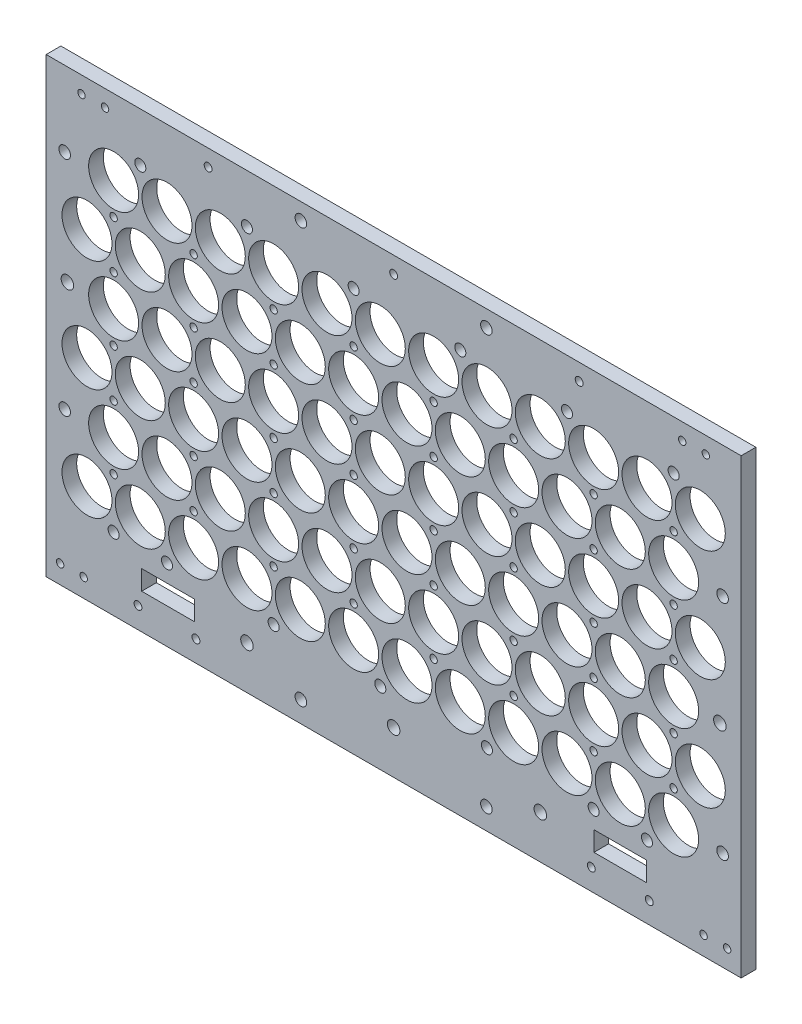
from build123d import *

# Parameters (mm, degrees)
SKETCH1_W                  = 299.700000132
SKETCH1_H                  = 194.250000104
BOSS_EXTRUDE1_DEPTH        = 6.35
CUT_EXTRUDE1_DEPTH         = 182.719853184
SKETCH4_R                  = 10.775
CUT_EXTRUDE2_DEPTH         = 182.719853184
LPATTERN1_COUNT            = 12
LPATTERN1_PITCH            = 23
LPATTERN2_COPY_1_DEPTH     = 182.719853184
LPATTERN2_COPY_2_DEPTH     = 182.719853184
LPATTERN2_COPY_3_DEPTH     = 182.719853184
LPATTERN2_COPY_4_DEPTH     = 182.719853184
LPATTERN2_COPY_5_DEPTH     = 182.719853184
LPATTERN2_COPY_6_DEPTH     = 182.719853184
LPATTERN2_COPY_7_DEPTH     = 182.719853184
LPATTERN2_COPY_8_DEPTH     = 182.719853184
LPATTERN2_COPY_9_DEPTH     = 182.719853184
LPATTERN2_COPY_10_DEPTH    = 182.719853184
LPATTERN2_COPY_11_DEPTH    = 182.719853184
LPATTERN2_COPY_12_DEPTH    = 182.719853184
LPATTERN2_COPY_13_DEPTH    = 182.719853184
LPATTERN2_COPY_14_DEPTH    = 182.719853184
LPATTERN2_COPY_15_DEPTH    = 182.719853184
LPATTERN2_COPY_16_DEPTH    = 182.719853184
LPATTERN2_COPY_17_DEPTH    = 182.719853184
LPATTERN2_COPY_18_DEPTH    = 182.719853184
LPATTERN2_COPY_19_DEPTH    = 182.719853184
LPATTERN2_COPY_20_DEPTH    = 182.719853184
LPATTERN2_COPY_21_DEPTH    = 182.719853184
LPATTERN2_COPY_22_DEPTH    = 182.719853184
LPATTERN2_COPY_23_SKETCH_R = 10.775
LPATTERN2_COPY_23_DEPTH    = 182.719853184
LPATTERN2_COPY_24_SKETCH_R = 10.775
LPATTERN2_COPY_24_DEPTH    = 182.719853184
LPATTERN2_COPY_25_SKETCH_R = 10.775
LPATTERN2_COPY_25_DEPTH    = 182.719853184
LPATTERN2_COPY_26_SKETCH_R = 10.775
LPATTERN2_COPY_26_DEPTH    = 182.719853184
LPATTERN2_COPY_27_SKETCH_R = 10.775
LPATTERN2_COPY_27_DEPTH    = 182.719853184
LPATTERN2_COPY_28_SKETCH_R = 10.775
LPATTERN2_COPY_28_DEPTH    = 182.719853184
LPATTERN2_COPY_29_SKETCH_R = 10.775
LPATTERN2_COPY_29_DEPTH    = 182.719853184
LPATTERN2_COPY_30_SKETCH_R = 10.775
LPATTERN2_COPY_30_DEPTH    = 182.719853184
LPATTERN2_COPY_31_SKETCH_R = 10.775
LPATTERN2_COPY_31_DEPTH    = 182.719853184
LPATTERN2_COPY_32_SKETCH_R = 10.775
LPATTERN2_COPY_32_DEPTH    = 182.719853184
LPATTERN2_COPY_33_SKETCH_R = 10.775
LPATTERN2_COPY_33_DEPTH    = 182.719853184
LPATTERN2_COPY_34_SKETCH_R = 10.775
LPATTERN2_COPY_34_DEPTH    = 182.719853184
LPATTERN2_COPY_35_SKETCH_R = 10.775
LPATTERN2_COPY_35_DEPTH    = 182.719853184
LPATTERN2_COPY_36_SKETCH_R = 10.775
LPATTERN2_COPY_36_DEPTH    = 182.719853184
LPATTERN2_COPY_37_SKETCH_R = 10.775
LPATTERN2_COPY_37_DEPTH    = 182.719853184
LPATTERN2_COPY_38_SKETCH_R = 10.775
LPATTERN2_COPY_38_DEPTH    = 182.719853184
LPATTERN2_COPY_39_SKETCH_R = 10.775
LPATTERN2_COPY_39_DEPTH    = 182.719853184
LPATTERN2_COPY_40_SKETCH_R = 10.775
LPATTERN2_COPY_40_DEPTH    = 182.719853184
LPATTERN2_COPY_41_SKETCH_R = 10.775
LPATTERN2_COPY_41_DEPTH    = 182.719853184
LPATTERN2_COPY_42_SKETCH_R = 10.775
LPATTERN2_COPY_42_DEPTH    = 182.719853184
LPATTERN2_COPY_43_SKETCH_R = 10.775
LPATTERN2_COPY_43_DEPTH    = 182.719853184
LPATTERN2_COPY_44_SKETCH_R = 10.775
LPATTERN2_COPY_44_DEPTH    = 182.719853184
LPATTERN2_COPY_45_DEPTH    = 182.719853184
LPATTERN2_COPY_46_DEPTH    = 182.719853184
LPATTERN2_COPY_47_SKETCH_R = 10.775
LPATTERN2_COPY_47_DEPTH    = 182.719853184
LPATTERN2_COPY_48_SKETCH_R = 10.775
LPATTERN2_COPY_48_DEPTH    = 182.719853184
SKETCH5_W                  = 22.76
SKETCH5_H                  = 8.4615
CUT_EXTRUDE3_DEPTH         = 182.719853184
M3_CLEARANCE_HOLE1_D       = 3.2
M3_CLEARANCE_HOLE2_D       = 3.4
SKETCH14_R                 = 2.7
CUT_EXTRUDE4_DEPTH         = 182.719853184
SKETCH15_R                 = 2.5
CUT_EXTRUDE5_DEPTH         = 182.719853184
SKETCH16_R                 = 1.5875
CUT_EXTRUDE6_DEPTH         = 182.719853184
LPATTERN3_COUNT            = 4
LPATTERN3_PITCH            = 69
SKETCH18_R                 = 2.38125
CUT_EXTRUDE7_DEPTH         = 182.719853184
SKETCH19_W                 = 299.700000132
SKETCH19_H                 = 6.35
BOSS_EXTRUDE2_DEPTH        = 0.79375


with BuildPart() as part:
    # Sketch1 → Boss-Extrude1 (new body)
    with BuildSketch(Plane.XY):
        with Locations((0, -5.475000052)):
            Rectangle(SKETCH1_W, SKETCH1_H)
    extrude(amount=BOSS_EXTRUDE1_DEPTH)

    # Sketch3 → Cut-Extrude1 (cut, through all)
    with BuildSketch(Plane.XY.offset(6.35)):
        with BuildLine():
            ThreePointArc((-121.475, -60), (-132.24999993, -49.225), (-143.025, -59.999999859))
            ThreePointArc((-143.025, -59.999999859), (-139.869075617, -67.619075517), (-132.25, -70.775))
            ThreePointArc((-132.25, -70.775), (-124.630924433, -67.619075567), (-121.475, -60))
        make_face()
    cut_extrude1 = extrude(amount=-CUT_EXTRUDE1_DEPTH, mode=Mode.SUBTRACT)

    # Sketch4 → Cut-Extrude2 (cut, through all)
    with BuildSketch(Plane.XY.offset(6.35)):
        with Locations((-120.75, -36)):
            Circle(SKETCH4_R)
    cut_extrude2 = extrude(amount=-CUT_EXTRUDE2_DEPTH, mode=Mode.SUBTRACT)

    # LPattern1: Cut-Extrude1, Cut-Extrude2 ×12
    with Locations(*[(i * LPATTERN1_PITCH, 0, 0) for i in range(1, LPATTERN1_COUNT)]):
        add(cut_extrude1, mode=Mode.SUBTRACT)
        add(cut_extrude2, mode=Mode.SUBTRACT)

    # LPattern2 copy 1 sketch → LPattern2 copy 1 (cut, through all)
    with BuildSketch(Plane(origin=(23, 48, 6.35), x_dir=(1, 0, 0), z_dir=(0, 0, 1))):
        with BuildLine():
            ThreePointArc((-121.475, -60), (-132.24999993, -49.225), (-143.025, -59.999999859))
            ThreePointArc((-143.025, -59.999999859), (-139.869075617, -67.619075517), (-132.25, -70.775))
            ThreePointArc((-132.25, -70.775), (-124.630924433, -67.619075567), (-121.475, -60))
        make_face()
    extrude(amount=-LPATTERN2_COPY_1_DEPTH, mode=Mode.SUBTRACT)

    # LPattern2 copy 2 sketch → LPattern2 copy 2 (cut, through all)
    with BuildSketch(Plane(origin=(23, 96, 6.35), x_dir=(1, 0, 0), z_dir=(0, 0, 1))):
        with BuildLine():
            ThreePointArc((-121.475, -60), (-132.24999993, -49.225), (-143.025, -59.999999859))
            ThreePointArc((-143.025, -59.999999859), (-139.869075617, -67.619075517), (-132.25, -70.775))
            ThreePointArc((-132.25, -70.775), (-124.630924433, -67.619075567), (-121.475, -60))
        make_face()
    extrude(amount=-LPATTERN2_COPY_2_DEPTH, mode=Mode.SUBTRACT)

    # LPattern2 copy 3 sketch → LPattern2 copy 3 (cut, through all)
    with BuildSketch(Plane(origin=(46, 48, 6.35), x_dir=(1, 0, 0), z_dir=(0, 0, 1))):
        with BuildLine():
            ThreePointArc((-121.475, -60), (-132.24999993, -49.225), (-143.025, -59.999999859))
            ThreePointArc((-143.025, -59.999999859), (-139.869075617, -67.619075517), (-132.25, -70.775))
            ThreePointArc((-132.25, -70.775), (-124.630924433, -67.619075567), (-121.475, -60))
        make_face()
    extrude(amount=-LPATTERN2_COPY_3_DEPTH, mode=Mode.SUBTRACT)

    # LPattern2 copy 4 sketch → LPattern2 copy 4 (cut, through all)
    with BuildSketch(Plane(origin=(46, 96, 6.35), x_dir=(1, 0, 0), z_dir=(0, 0, 1))):
        with BuildLine():
            ThreePointArc((-121.475, -60), (-132.24999993, -49.225), (-143.025, -59.999999859))
            ThreePointArc((-143.025, -59.999999859), (-139.869075617, -67.619075517), (-132.25, -70.775))
            ThreePointArc((-132.25, -70.775), (-124.630924433, -67.619075567), (-121.475, -60))
        make_face()
    extrude(amount=-LPATTERN2_COPY_4_DEPTH, mode=Mode.SUBTRACT)

    # LPattern2 copy 5 sketch → LPattern2 copy 5 (cut, through all)
    with BuildSketch(Plane(origin=(69, 48, 6.35), x_dir=(1, 0, 0), z_dir=(0, 0, 1))):
        with BuildLine():
            ThreePointArc((-121.475, -60), (-132.24999993, -49.225), (-143.025, -59.999999859))
            ThreePointArc((-143.025, -59.999999859), (-139.869075617, -67.619075517), (-132.25, -70.775))
            ThreePointArc((-132.25, -70.775), (-124.630924433, -67.619075567), (-121.475, -60))
        make_face()
    extrude(amount=-LPATTERN2_COPY_5_DEPTH, mode=Mode.SUBTRACT)

    # LPattern2 copy 6 sketch → LPattern2 copy 6 (cut, through all)
    with BuildSketch(Plane(origin=(69, 96, 6.35), x_dir=(1, 0, 0), z_dir=(0, 0, 1))):
        with BuildLine():
            ThreePointArc((-121.475, -60), (-132.24999993, -49.225), (-143.025, -59.999999859))
            ThreePointArc((-143.025, -59.999999859), (-139.869075617, -67.619075517), (-132.25, -70.775))
            ThreePointArc((-132.25, -70.775), (-124.630924433, -67.619075567), (-121.475, -60))
        make_face()
    extrude(amount=-LPATTERN2_COPY_6_DEPTH, mode=Mode.SUBTRACT)

    # LPattern2 copy 7 sketch → LPattern2 copy 7 (cut, through all)
    with BuildSketch(Plane(origin=(92, 48, 6.35), x_dir=(1, 0, 0), z_dir=(0, 0, 1))):
        with BuildLine():
            ThreePointArc((-121.475, -60), (-132.24999993, -49.225), (-143.025, -59.999999859))
            ThreePointArc((-143.025, -59.999999859), (-139.869075617, -67.619075517), (-132.25, -70.775))
            ThreePointArc((-132.25, -70.775), (-124.630924433, -67.619075567), (-121.475, -60))
        make_face()
    extrude(amount=-LPATTERN2_COPY_7_DEPTH, mode=Mode.SUBTRACT)

    # LPattern2 copy 8 sketch → LPattern2 copy 8 (cut, through all)
    with BuildSketch(Plane(origin=(92, 96, 6.35), x_dir=(1, 0, 0), z_dir=(0, 0, 1))):
        with BuildLine():
            ThreePointArc((-121.475, -60), (-132.24999993, -49.225), (-143.025, -59.999999859))
            ThreePointArc((-143.025, -59.999999859), (-139.869075617, -67.619075517), (-132.25, -70.775))
            ThreePointArc((-132.25, -70.775), (-124.630924433, -67.619075567), (-121.475, -60))
        make_face()
    extrude(amount=-LPATTERN2_COPY_8_DEPTH, mode=Mode.SUBTRACT)

    # LPattern2 copy 9 sketch → LPattern2 copy 9 (cut, through all)
    with BuildSketch(Plane(origin=(115, 48, 6.35), x_dir=(1, 0, 0), z_dir=(0, 0, 1))):
        with BuildLine():
            ThreePointArc((-121.475, -60), (-132.24999993, -49.225), (-143.025, -59.999999859))
            ThreePointArc((-143.025, -59.999999859), (-139.869075617, -67.619075517), (-132.25, -70.775))
            ThreePointArc((-132.25, -70.775), (-124.630924433, -67.619075567), (-121.475, -60))
        make_face()
    extrude(amount=-LPATTERN2_COPY_9_DEPTH, mode=Mode.SUBTRACT)

    # LPattern2 copy 10 sketch → LPattern2 copy 10 (cut, through all)
    with BuildSketch(Plane(origin=(115, 96, 6.35), x_dir=(1, 0, 0), z_dir=(0, 0, 1))):
        with BuildLine():
            ThreePointArc((-121.475, -60), (-132.24999993, -49.225), (-143.025, -59.999999859))
            ThreePointArc((-143.025, -59.999999859), (-139.869075617, -67.619075517), (-132.25, -70.775))
            ThreePointArc((-132.25, -70.775), (-124.630924433, -67.619075567), (-121.475, -60))
        make_face()
    extrude(amount=-LPATTERN2_COPY_10_DEPTH, mode=Mode.SUBTRACT)

    # LPattern2 copy 11 sketch → LPattern2 copy 11 (cut, through all)
    with BuildSketch(Plane(origin=(138, 48, 6.35), x_dir=(1, 0, 0), z_dir=(0, 0, 1))):
        with BuildLine():
            ThreePointArc((-121.475, -60), (-132.24999993, -49.225), (-143.025, -59.999999859))
            ThreePointArc((-143.025, -59.999999859), (-139.869075617, -67.619075517), (-132.25, -70.775))
            ThreePointArc((-132.25, -70.775), (-124.630924433, -67.619075567), (-121.475, -60))
        make_face()
    extrude(amount=-LPATTERN2_COPY_11_DEPTH, mode=Mode.SUBTRACT)

    # LPattern2 copy 12 sketch → LPattern2 copy 12 (cut, through all)
    with BuildSketch(Plane(origin=(138, 96, 6.35), x_dir=(1, 0, 0), z_dir=(0, 0, 1))):
        with BuildLine():
            ThreePointArc((-121.475, -60), (-132.24999993, -49.225), (-143.025, -59.999999859))
            ThreePointArc((-143.025, -59.999999859), (-139.869075617, -67.619075517), (-132.25, -70.775))
            ThreePointArc((-132.25, -70.775), (-124.630924433, -67.619075567), (-121.475, -60))
        make_face()
    extrude(amount=-LPATTERN2_COPY_12_DEPTH, mode=Mode.SUBTRACT)

    # LPattern2 copy 13 sketch → LPattern2 copy 13 (cut, through all)
    with BuildSketch(Plane(origin=(161, 48, 6.35), x_dir=(1, 0, 0), z_dir=(0, 0, 1))):
        with BuildLine():
            ThreePointArc((-121.475, -60), (-132.24999993, -49.225), (-143.025, -59.999999859))
            ThreePointArc((-143.025, -59.999999859), (-139.869075617, -67.619075517), (-132.25, -70.775))
            ThreePointArc((-132.25, -70.775), (-124.630924433, -67.619075567), (-121.475, -60))
        make_face()
    extrude(amount=-LPATTERN2_COPY_13_DEPTH, mode=Mode.SUBTRACT)

    # LPattern2 copy 14 sketch → LPattern2 copy 14 (cut, through all)
    with BuildSketch(Plane(origin=(161, 96, 6.35), x_dir=(1, 0, 0), z_dir=(0, 0, 1))):
        with BuildLine():
            ThreePointArc((-121.475, -60), (-132.24999993, -49.225), (-143.025, -59.999999859))
            ThreePointArc((-143.025, -59.999999859), (-139.869075617, -67.619075517), (-132.25, -70.775))
            ThreePointArc((-132.25, -70.775), (-124.630924433, -67.619075567), (-121.475, -60))
        make_face()
    extrude(amount=-LPATTERN2_COPY_14_DEPTH, mode=Mode.SUBTRACT)

    # LPattern2 copy 15 sketch → LPattern2 copy 15 (cut, through all)
    with BuildSketch(Plane(origin=(184, 48, 6.35), x_dir=(1, 0, 0), z_dir=(0, 0, 1))):
        with BuildLine():
            ThreePointArc((-121.475, -60), (-132.24999993, -49.225), (-143.025, -59.999999859))
            ThreePointArc((-143.025, -59.999999859), (-139.869075617, -67.619075517), (-132.25, -70.775))
            ThreePointArc((-132.25, -70.775), (-124.630924433, -67.619075567), (-121.475, -60))
        make_face()
    extrude(amount=-LPATTERN2_COPY_15_DEPTH, mode=Mode.SUBTRACT)

    # LPattern2 copy 16 sketch → LPattern2 copy 16 (cut, through all)
    with BuildSketch(Plane(origin=(184, 96, 6.35), x_dir=(1, 0, 0), z_dir=(0, 0, 1))):
        with BuildLine():
            ThreePointArc((-121.475, -60), (-132.24999993, -49.225), (-143.025, -59.999999859))
            ThreePointArc((-143.025, -59.999999859), (-139.869075617, -67.619075517), (-132.25, -70.775))
            ThreePointArc((-132.25, -70.775), (-124.630924433, -67.619075567), (-121.475, -60))
        make_face()
    extrude(amount=-LPATTERN2_COPY_16_DEPTH, mode=Mode.SUBTRACT)

    # LPattern2 copy 17 sketch → LPattern2 copy 17 (cut, through all)
    with BuildSketch(Plane(origin=(207, 48, 6.35), x_dir=(1, 0, 0), z_dir=(0, 0, 1))):
        with BuildLine():
            ThreePointArc((-121.475, -60), (-132.24999993, -49.225), (-143.025, -59.999999859))
            ThreePointArc((-143.025, -59.999999859), (-139.869075617, -67.619075517), (-132.25, -70.775))
            ThreePointArc((-132.25, -70.775), (-124.630924433, -67.619075567), (-121.475, -60))
        make_face()
    extrude(amount=-LPATTERN2_COPY_17_DEPTH, mode=Mode.SUBTRACT)

    # LPattern2 copy 18 sketch → LPattern2 copy 18 (cut, through all)
    with BuildSketch(Plane(origin=(207, 96, 6.35), x_dir=(1, 0, 0), z_dir=(0, 0, 1))):
        with BuildLine():
            ThreePointArc((-121.475, -60), (-132.24999993, -49.225), (-143.025, -59.999999859))
            ThreePointArc((-143.025, -59.999999859), (-139.869075617, -67.619075517), (-132.25, -70.775))
            ThreePointArc((-132.25, -70.775), (-124.630924433, -67.619075567), (-121.475, -60))
        make_face()
    extrude(amount=-LPATTERN2_COPY_18_DEPTH, mode=Mode.SUBTRACT)

    # LPattern2 copy 19 sketch → LPattern2 copy 19 (cut, through all)
    with BuildSketch(Plane(origin=(230, 48, 6.35), x_dir=(1, 0, 0), z_dir=(0, 0, 1))):
        with BuildLine():
            ThreePointArc((-121.475, -60), (-132.24999993, -49.225), (-143.025, -59.999999859))
            ThreePointArc((-143.025, -59.999999859), (-139.869075617, -67.619075517), (-132.25, -70.775))
            ThreePointArc((-132.25, -70.775), (-124.630924433, -67.619075567), (-121.475, -60))
        make_face()
    extrude(amount=-LPATTERN2_COPY_19_DEPTH, mode=Mode.SUBTRACT)

    # LPattern2 copy 20 sketch → LPattern2 copy 20 (cut, through all)
    with BuildSketch(Plane(origin=(230, 96, 6.35), x_dir=(1, 0, 0), z_dir=(0, 0, 1))):
        with BuildLine():
            ThreePointArc((-121.475, -60), (-132.24999993, -49.225), (-143.025, -59.999999859))
            ThreePointArc((-143.025, -59.999999859), (-139.869075617, -67.619075517), (-132.25, -70.775))
            ThreePointArc((-132.25, -70.775), (-124.630924433, -67.619075567), (-121.475, -60))
        make_face()
    extrude(amount=-LPATTERN2_COPY_20_DEPTH, mode=Mode.SUBTRACT)

    # LPattern2 copy 21 sketch → LPattern2 copy 21 (cut, through all)
    with BuildSketch(Plane(origin=(253, 48, 6.35), x_dir=(1, 0, 0), z_dir=(0, 0, 1))):
        with BuildLine():
            ThreePointArc((-121.475, -60), (-132.24999993, -49.225), (-143.025, -59.999999859))
            ThreePointArc((-143.025, -59.999999859), (-139.869075617, -67.619075517), (-132.25, -70.775))
            ThreePointArc((-132.25, -70.775), (-124.630924433, -67.619075567), (-121.475, -60))
        make_face()
    extrude(amount=-LPATTERN2_COPY_21_DEPTH, mode=Mode.SUBTRACT)

    # LPattern2 copy 22 sketch → LPattern2 copy 22 (cut, through all)
    with BuildSketch(Plane(origin=(253, 96, 6.35), x_dir=(1, 0, 0), z_dir=(0, 0, 1))):
        with BuildLine():
            ThreePointArc((-121.475, -60), (-132.24999993, -49.225), (-143.025, -59.999999859))
            ThreePointArc((-143.025, -59.999999859), (-139.869075617, -67.619075517), (-132.25, -70.775))
            ThreePointArc((-132.25, -70.775), (-124.630924433, -67.619075567), (-121.475, -60))
        make_face()
    extrude(amount=-LPATTERN2_COPY_22_DEPTH, mode=Mode.SUBTRACT)

    # LPattern2 copy 23 sketch → LPattern2 copy 23 (cut, through all)
    with BuildSketch(Plane(origin=(23, 48, 6.35), x_dir=(1, 0, 0), z_dir=(0, 0, 1))):
        with Locations((-120.75, -36)):
            Circle(LPATTERN2_COPY_23_SKETCH_R)
    extrude(amount=-LPATTERN2_COPY_23_DEPTH, mode=Mode.SUBTRACT)

    # LPattern2 copy 24 sketch → LPattern2 copy 24 (cut, through all)
    with BuildSketch(Plane(origin=(23, 96, 6.35), x_dir=(1, 0, 0), z_dir=(0, 0, 1))):
        with Locations((-120.75, -36)):
            Circle(LPATTERN2_COPY_24_SKETCH_R)
    extrude(amount=-LPATTERN2_COPY_24_DEPTH, mode=Mode.SUBTRACT)

    # LPattern2 copy 25 sketch → LPattern2 copy 25 (cut, through all)
    with BuildSketch(Plane(origin=(46, 48, 6.35), x_dir=(1, 0, 0), z_dir=(0, 0, 1))):
        with Locations((-120.75, -36)):
            Circle(LPATTERN2_COPY_25_SKETCH_R)
    extrude(amount=-LPATTERN2_COPY_25_DEPTH, mode=Mode.SUBTRACT)

    # LPattern2 copy 26 sketch → LPattern2 copy 26 (cut, through all)
    with BuildSketch(Plane(origin=(46, 96, 6.35), x_dir=(1, 0, 0), z_dir=(0, 0, 1))):
        with Locations((-120.75, -36)):
            Circle(LPATTERN2_COPY_26_SKETCH_R)
    extrude(amount=-LPATTERN2_COPY_26_DEPTH, mode=Mode.SUBTRACT)

    # LPattern2 copy 27 sketch → LPattern2 copy 27 (cut, through all)
    with BuildSketch(Plane(origin=(69, 48, 6.35), x_dir=(1, 0, 0), z_dir=(0, 0, 1))):
        with Locations((-120.75, -36)):
            Circle(LPATTERN2_COPY_27_SKETCH_R)
    extrude(amount=-LPATTERN2_COPY_27_DEPTH, mode=Mode.SUBTRACT)

    # LPattern2 copy 28 sketch → LPattern2 copy 28 (cut, through all)
    with BuildSketch(Plane(origin=(69, 96, 6.35), x_dir=(1, 0, 0), z_dir=(0, 0, 1))):
        with Locations((-120.75, -36)):
            Circle(LPATTERN2_COPY_28_SKETCH_R)
    extrude(amount=-LPATTERN2_COPY_28_DEPTH, mode=Mode.SUBTRACT)

    # LPattern2 copy 29 sketch → LPattern2 copy 29 (cut, through all)
    with BuildSketch(Plane(origin=(92, 48, 6.35), x_dir=(1, 0, 0), z_dir=(0, 0, 1))):
        with Locations((-120.75, -36)):
            Circle(LPATTERN2_COPY_29_SKETCH_R)
    extrude(amount=-LPATTERN2_COPY_29_DEPTH, mode=Mode.SUBTRACT)

    # LPattern2 copy 30 sketch → LPattern2 copy 30 (cut, through all)
    with BuildSketch(Plane(origin=(92, 96, 6.35), x_dir=(1, 0, 0), z_dir=(0, 0, 1))):
        with Locations((-120.75, -36)):
            Circle(LPATTERN2_COPY_30_SKETCH_R)
    extrude(amount=-LPATTERN2_COPY_30_DEPTH, mode=Mode.SUBTRACT)

    # LPattern2 copy 31 sketch → LPattern2 copy 31 (cut, through all)
    with BuildSketch(Plane(origin=(115, 48, 6.35), x_dir=(1, 0, 0), z_dir=(0, 0, 1))):
        with Locations((-120.75, -36)):
            Circle(LPATTERN2_COPY_31_SKETCH_R)
    extrude(amount=-LPATTERN2_COPY_31_DEPTH, mode=Mode.SUBTRACT)

    # LPattern2 copy 32 sketch → LPattern2 copy 32 (cut, through all)
    with BuildSketch(Plane(origin=(115, 96, 6.35), x_dir=(1, 0, 0), z_dir=(0, 0, 1))):
        with Locations((-120.75, -36)):
            Circle(LPATTERN2_COPY_32_SKETCH_R)
    extrude(amount=-LPATTERN2_COPY_32_DEPTH, mode=Mode.SUBTRACT)

    # LPattern2 copy 33 sketch → LPattern2 copy 33 (cut, through all)
    with BuildSketch(Plane(origin=(138, 48, 6.35), x_dir=(1, 0, 0), z_dir=(0, 0, 1))):
        with Locations((-120.75, -36)):
            Circle(LPATTERN2_COPY_33_SKETCH_R)
    extrude(amount=-LPATTERN2_COPY_33_DEPTH, mode=Mode.SUBTRACT)

    # LPattern2 copy 34 sketch → LPattern2 copy 34 (cut, through all)
    with BuildSketch(Plane(origin=(138, 96, 6.35), x_dir=(1, 0, 0), z_dir=(0, 0, 1))):
        with Locations((-120.75, -36)):
            Circle(LPATTERN2_COPY_34_SKETCH_R)
    extrude(amount=-LPATTERN2_COPY_34_DEPTH, mode=Mode.SUBTRACT)

    # LPattern2 copy 35 sketch → LPattern2 copy 35 (cut, through all)
    with BuildSketch(Plane(origin=(161, 48, 6.35), x_dir=(1, 0, 0), z_dir=(0, 0, 1))):
        with Locations((-120.75, -36)):
            Circle(LPATTERN2_COPY_35_SKETCH_R)
    extrude(amount=-LPATTERN2_COPY_35_DEPTH, mode=Mode.SUBTRACT)

    # LPattern2 copy 36 sketch → LPattern2 copy 36 (cut, through all)
    with BuildSketch(Plane(origin=(161, 96, 6.35), x_dir=(1, 0, 0), z_dir=(0, 0, 1))):
        with Locations((-120.75, -36)):
            Circle(LPATTERN2_COPY_36_SKETCH_R)
    extrude(amount=-LPATTERN2_COPY_36_DEPTH, mode=Mode.SUBTRACT)

    # LPattern2 copy 37 sketch → LPattern2 copy 37 (cut, through all)
    with BuildSketch(Plane(origin=(184, 48, 6.35), x_dir=(1, 0, 0), z_dir=(0, 0, 1))):
        with Locations((-120.75, -36)):
            Circle(LPATTERN2_COPY_37_SKETCH_R)
    extrude(amount=-LPATTERN2_COPY_37_DEPTH, mode=Mode.SUBTRACT)

    # LPattern2 copy 38 sketch → LPattern2 copy 38 (cut, through all)
    with BuildSketch(Plane(origin=(184, 96, 6.35), x_dir=(1, 0, 0), z_dir=(0, 0, 1))):
        with Locations((-120.75, -36)):
            Circle(LPATTERN2_COPY_38_SKETCH_R)
    extrude(amount=-LPATTERN2_COPY_38_DEPTH, mode=Mode.SUBTRACT)

    # LPattern2 copy 39 sketch → LPattern2 copy 39 (cut, through all)
    with BuildSketch(Plane(origin=(207, 48, 6.35), x_dir=(1, 0, 0), z_dir=(0, 0, 1))):
        with Locations((-120.75, -36)):
            Circle(LPATTERN2_COPY_39_SKETCH_R)
    extrude(amount=-LPATTERN2_COPY_39_DEPTH, mode=Mode.SUBTRACT)

    # LPattern2 copy 40 sketch → LPattern2 copy 40 (cut, through all)
    with BuildSketch(Plane(origin=(207, 96, 6.35), x_dir=(1, 0, 0), z_dir=(0, 0, 1))):
        with Locations((-120.75, -36)):
            Circle(LPATTERN2_COPY_40_SKETCH_R)
    extrude(amount=-LPATTERN2_COPY_40_DEPTH, mode=Mode.SUBTRACT)

    # LPattern2 copy 41 sketch → LPattern2 copy 41 (cut, through all)
    with BuildSketch(Plane(origin=(230, 48, 6.35), x_dir=(1, 0, 0), z_dir=(0, 0, 1))):
        with Locations((-120.75, -36)):
            Circle(LPATTERN2_COPY_41_SKETCH_R)
    extrude(amount=-LPATTERN2_COPY_41_DEPTH, mode=Mode.SUBTRACT)

    # LPattern2 copy 42 sketch → LPattern2 copy 42 (cut, through all)
    with BuildSketch(Plane(origin=(230, 96, 6.35), x_dir=(1, 0, 0), z_dir=(0, 0, 1))):
        with Locations((-120.75, -36)):
            Circle(LPATTERN2_COPY_42_SKETCH_R)
    extrude(amount=-LPATTERN2_COPY_42_DEPTH, mode=Mode.SUBTRACT)

    # LPattern2 copy 43 sketch → LPattern2 copy 43 (cut, through all)
    with BuildSketch(Plane(origin=(253, 48, 6.35), x_dir=(1, 0, 0), z_dir=(0, 0, 1))):
        with Locations((-120.75, -36)):
            Circle(LPATTERN2_COPY_43_SKETCH_R)
    extrude(amount=-LPATTERN2_COPY_43_DEPTH, mode=Mode.SUBTRACT)

    # LPattern2 copy 44 sketch → LPattern2 copy 44 (cut, through all)
    with BuildSketch(Plane(origin=(253, 96, 6.35), x_dir=(1, 0, 0), z_dir=(0, 0, 1))):
        with Locations((-120.75, -36)):
            Circle(LPATTERN2_COPY_44_SKETCH_R)
    extrude(amount=-LPATTERN2_COPY_44_DEPTH, mode=Mode.SUBTRACT)

    # LPattern2 copy 45 sketch → LPattern2 copy 45 (cut, through all)
    with BuildSketch(Plane(origin=(0, 48, 6.35), x_dir=(1, 0, 0), z_dir=(0, 0, 1))):
        with BuildLine():
            ThreePointArc((-121.475, -60), (-132.24999993, -49.225), (-143.025, -59.999999859))
            ThreePointArc((-143.025, -59.999999859), (-139.869075617, -67.619075517), (-132.25, -70.775))
            ThreePointArc((-132.25, -70.775), (-124.630924433, -67.619075567), (-121.475, -60))
        make_face()
    extrude(amount=-LPATTERN2_COPY_45_DEPTH, mode=Mode.SUBTRACT)

    # LPattern2 copy 46 sketch → LPattern2 copy 46 (cut, through all)
    with BuildSketch(Plane(origin=(0, 96, 6.35), x_dir=(1, 0, 0), z_dir=(0, 0, 1))):
        with BuildLine():
            ThreePointArc((-121.475, -60), (-132.24999993, -49.225), (-143.025, -59.999999859))
            ThreePointArc((-143.025, -59.999999859), (-139.869075617, -67.619075517), (-132.25, -70.775))
            ThreePointArc((-132.25, -70.775), (-124.630924433, -67.619075567), (-121.475, -60))
        make_face()
    extrude(amount=-LPATTERN2_COPY_46_DEPTH, mode=Mode.SUBTRACT)

    # LPattern2 copy 47 sketch → LPattern2 copy 47 (cut, through all)
    with BuildSketch(Plane(origin=(0, 48, 6.35), x_dir=(1, 0, 0), z_dir=(0, 0, 1))):
        with Locations((-120.75, -36)):
            Circle(LPATTERN2_COPY_47_SKETCH_R)
    extrude(amount=-LPATTERN2_COPY_47_DEPTH, mode=Mode.SUBTRACT)

    # LPattern2 copy 48 sketch → LPattern2 copy 48 (cut, through all)
    with BuildSketch(Plane(origin=(0, 96, 6.35), x_dir=(1, 0, 0), z_dir=(0, 0, 1))):
        with Locations((-120.75, -36)):
            Circle(LPATTERN2_COPY_48_SKETCH_R)
    extrude(amount=-LPATTERN2_COPY_48_DEPTH, mode=Mode.SUBTRACT)

    # Sketch5 → Cut-Extrude3 (cut, through all)
    with BuildSketch(Plane.XY.offset(6.35)):
        with Locations((97.75, -83.18075)):
            Rectangle(SKETCH5_W, SKETCH5_H)
        with Locations((-97.288, -83.18075)):
            Rectangle(SKETCH5_W, SKETCH5_H)
    extrude(amount=-CUT_EXTRUDE3_DEPTH, mode=Mode.SUBTRACT)

    # M3 Clearance Hole1 (through all)
    with Locations(Plane.XY.offset(6.35)):
        with Locations((124.450000066, 85.3), (134.610000066, 85.3), (-124.450000066, 85.3), (-134.610000066, 85.3), (-143.817500066, -94.6000001), (-133.657500066, -94.6000001), (133.657500066, -94.6000001), (143.817500066, -94.6000001)):
            Hole(M3_CLEARANCE_HOLE1_D / 2)

    # M3 Clearance Hole2 (through all)
    with Locations(Plane.XY.offset(6.35)):
        with Locations((110.25, -93.50575), (85.25, -93.50575), (-80, 85.3), (0, 85.3), (80, 85.3), (-85.25, -93.50575), (-110.25, -93.50575)):
            Hole(M3_CLEARANCE_HOLE2_D / 2)

    # Sketch14 → Cut-Extrude4 (cut, through all)
    with BuildSketch(Plane.XY.offset(6.35)):
        with Locations((140.687500033, -12)):
            Circle(SKETCH14_R)
        with Locations((-140.687500033, 12)):
            Circle(SKETCH14_R)
        with Locations((63.25, -83.95)):
            Circle(SKETCH14_R)
        with Locations((-63.25, -83.95)):
            Circle(SKETCH14_R)
        with Locations((0, -83.95)):
            Circle(SKETCH14_R)
    extrude(amount=-CUT_EXTRUDE4_DEPTH, mode=Mode.SUBTRACT)

    # Sketch15 → Cut-Extrude5 (cut, through all)
    with BuildSketch(Plane.XY.offset(6.35)):
        with Locations((-40, 85.3)):
            Circle(SKETCH15_R)
        with Locations((40, 85.3)):
            Circle(SKETCH15_R)
        with Locations((141.850000066, 36)):
            Circle(SKETCH15_R)
        with Locations((141.850000066, -60)):
            Circle(SKETCH15_R)
        with Locations((-141.850000066, -36)):
            Circle(SKETCH15_R)
        with Locations((-141.850000066, 60)):
            Circle(SKETCH15_R)
        with Locations((-40, -93.50575)):
            Circle(SKETCH15_R)
        with Locations((40, -93.50575)):
            Circle(SKETCH15_R)
    extrude(amount=-CUT_EXTRUDE5_DEPTH, mode=Mode.SUBTRACT)

    # Sketch16 → Cut-Extrude6 (cut, through all)
    with BuildSketch(Plane.XY.offset(6.35)):
        with Locations((86.25, -49.71)):
            Circle(SKETCH16_R)
        with Locations((120.75, -46.29)):
            Circle(SKETCH16_R)
        with Locations((120.75, -25.71)):
            Circle(SKETCH16_R)
        with Locations((86.25, -22.29)):
            Circle(SKETCH16_R)
        with Locations((120.75, 1.71)):
            Circle(SKETCH16_R)
        with Locations((86.25, -1.71)):
            Circle(SKETCH16_R)
        with Locations((120.75, 22.29)):
            Circle(SKETCH16_R)
        with Locations((86.25, 25.71)):
            Circle(SKETCH16_R)
        with Locations((120.75, 49.71)):
            Circle(SKETCH16_R)
        with Locations((86.25, 46.29)):
            Circle(SKETCH16_R)
    cut_extrude6 = extrude(amount=-CUT_EXTRUDE6_DEPTH, mode=Mode.SUBTRACT)

    # LPattern3: Cut-Extrude6 ×4
    with Locations(*[(-i * LPATTERN3_PITCH, 0, 0) for i in range(1, LPATTERN3_COUNT)]):
        add(cut_extrude6, mode=Mode.SUBTRACT)

    # Sketch18 → Cut-Extrude7 (cut, through all)
    with BuildSketch(Plane.XY.offset(6.35)):
        with Locations((109.25, -71.41)):
            Circle(SKETCH18_R)
        with Locations((86.25, -71.41)):
            Circle(SKETCH18_R)
        with Locations((120.75, 71.41)):
            Circle(SKETCH18_R)
        with Locations((74.75, 71.41)):
            Circle(SKETCH18_R)
        with Locations((28.75, 71.41)):
            Circle(SKETCH18_R)
        with Locations((-17.25, 71.41)):
            Circle(SKETCH18_R)
        with Locations((-63.25, 71.41)):
            Circle(SKETCH18_R)
        with Locations((-109.25, 71.41)):
            Circle(SKETCH18_R)
        with Locations((40.25, -71.41)):
            Circle(SKETCH18_R)
        with Locations((-5.75, -71.41)):
            Circle(SKETCH18_R)
        with Locations((-51.75, -71.41)):
            Circle(SKETCH18_R)
        with Locations((-97.75, -71.41)):
            Circle(SKETCH18_R)
        with Locations((-120.75, -71.41)):
            Circle(SKETCH18_R)
    extrude(amount=-CUT_EXTRUDE7_DEPTH, mode=Mode.SUBTRACT)

    # Sketch19 → Boss-Extrude2 (add)
    with BuildSketch(Plane(origin=(0, 91.65, 0), x_dir=(1, 0, 0), z_dir=(0, 1, 0))):
        with Locations((0, -3.175)):
            Rectangle(SKETCH19_W, SKETCH19_H)
    extrude(amount=BOSS_EXTRUDE2_DEPTH)


solid = part.part
